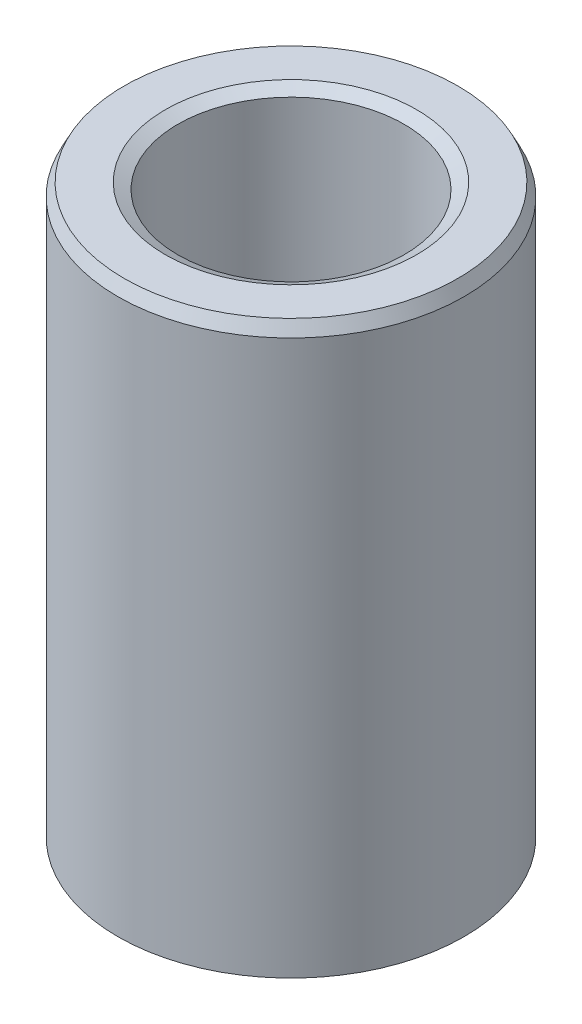
from build123d import *
from OCP.BRepFilletAPI import BRepFilletAPI_MakeChamfer

# Parameters (mm, degrees)
SKETCH1_R           = 35
BOSS_EXTRUDE1_DEPTH = 115.841860667
SKETCH2_R           = 22.868567474
CUT_EXTRUDE1_DEPTH  = 126.97355549
CHAMFER1_SIZE       = 2.533504924
CHAMFER1_SIZE2      = 1.283817898


with BuildPart() as part:
    # Sketch1 → Boss-Extrude1 (new body)
    with BuildSketch(Plane(origin=(0, 0, 0), x_dir=(1, 0, 0), z_dir=(0, 1, 0))):
        Circle(SKETCH1_R)
    extrude(amount=BOSS_EXTRUDE1_DEPTH)

    # Sketch2 → Cut-Extrude1 (cut, through all)
    with BuildSketch(Plane(origin=(0, 0, 0), x_dir=(1, 0, 0), z_dir=(0, 1, 0))):
        Circle(SKETCH2_R)
    extrude(amount=CUT_EXTRUDE1_DEPTH, mode=Mode.SUBTRACT)

    # Chamfer1: one chamfer whose edges measure the first distance from different faces: ONE call of the kernel's chamfer builder (chamfer() names one face for all edges)
    chamfer1_edges_1 = [part.edges().sort_by_distance(p)[0] for p in [
        (-22.868567474, 115.841860667, 0),
    ]]
    chamfer1_side_1 = [part.faces().sort_by_distance(p)[0] for p in [
        (-34.010050506, 115.841860667, 0),
    ]]
    chamfer1_edges_2 = [part.edges().sort_by_distance(p)[0] for p in [
        (-22.868567474, 0, 0),
    ]]
    chamfer1_side_2 = [part.faces().sort_by_distance(p)[0] for p in [
        (-22.868567474, 57.920930334, 0),
    ]]
    chamfer1_edges_3 = [part.edges().sort_by_distance(p)[0] for p in [
        (-35, 0, 0),
    ]]
    chamfer1_side_3 = [part.faces().sort_by_distance(p)[0] for p in [
        (-34.010050506, 0, 0),
    ]]
    chamfer1_edges_4 = [part.edges().sort_by_distance(p)[0] for p in [
        (-35, 115.841860667, 0),
    ]]
    chamfer1_side_4 = [part.faces().sort_by_distance(p)[0] for p in [
        (-35, 57.920930334, 0),
    ]]
    chamfer1 = BRepFilletAPI_MakeChamfer(part.part.solid().wrapped)
    for e in chamfer1_edges_1:
        chamfer1.Add(CHAMFER1_SIZE, CHAMFER1_SIZE2, e.wrapped, chamfer1_side_1[0].wrapped)  # the first distance lies on this face
    for e in chamfer1_edges_2:
        chamfer1.Add(CHAMFER1_SIZE, CHAMFER1_SIZE2, e.wrapped, chamfer1_side_2[0].wrapped)  # the first distance lies on this face
    for e in chamfer1_edges_3:
        chamfer1.Add(CHAMFER1_SIZE, CHAMFER1_SIZE2, e.wrapped, chamfer1_side_3[0].wrapped)  # the first distance lies on this face
    for e in chamfer1_edges_4:
        chamfer1.Add(CHAMFER1_SIZE, CHAMFER1_SIZE2, e.wrapped, chamfer1_side_4[0].wrapped)  # the first distance lies on this face
    add(Compound.cast(chamfer1.Shape()), mode=Mode.REPLACE)


solid = part.part
